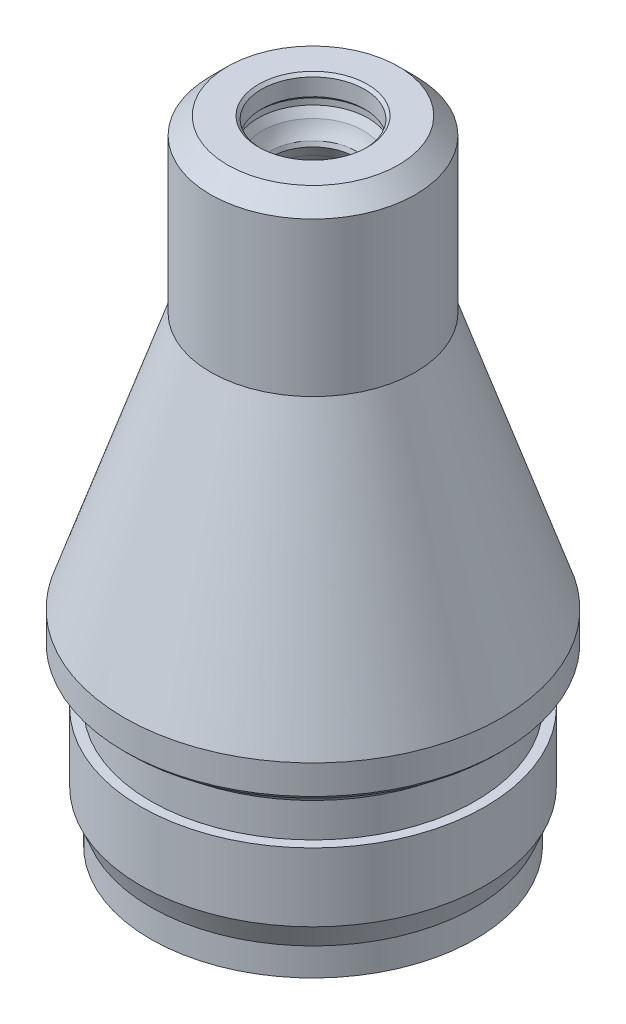
from build123d import *

# Parameters (mm, degrees)
CHAMFER_1_SIZE = 1
CHAMFER_2_SIZE = 0.1
CHAMFER_3_SIZE = 0.3


with BuildPart() as part:
    # 스케치1 → 회전1 (revolve)
    with BuildSketch(Plane(origin=(0, 0, 0), x_dir=(0, 0, -1), z_dir=(1, 0, 0))):
        with BuildLine():
            Line((4.2, 0), (4.2, 1))
            Line((4.2, 1), (4.2, 7))
            Line((4.2, 7), (4.7, 7.500000078))
            Line((4.7, 7.500000078), (4.7, 8.000000078))
            Line((4.7, 8.000000078), (4.2, 8.5))
            Line((4.2, 8.5), (4.2, 10))
            Line((4.2, 10), (4.7, 10.500000078))
            Line((4.7, 10.500000078), (4.7, 11.000000078))
            Line((4.7, 11.000000078), (4.2, 11.5))
            Line((4.2, 11.5), (4.2, 13))
            Line((4.2, 13), (4.7, 13.500000078))
            Line((4.7, 13.500000078), (4.7, 14.000000078))
            Line((4.7, 14.000000078), (4.2, 14.5))
            Line((4.2, 14.5), (4.2, 28))
            Line((4.2, 28), (3.533728258, 29.430530536))
            Line((3.533728258, 29.430530536), (2.802745502, 31))
            Line((2.802745502, 31), (2.399244734, 31.778552392))
            ThreePointArc((2.399244734, 31.778552392), (2.719290067, 32.253174869), (2.946609162, 32.778552392))
            Line((2.946609162, 32.778552392), (3.229990685, 33.260397004))
            Line((3.229990685, 33.260397004), (3.229990685, 33.62037773))
            Line((3.229990685, 33.62037773), (3.02, 33.830368416))
            Line((3.02, 33.830368416), (3.02, 34.830368416))
            Line((3.02, 34.830368416), (3.189631584, 35))
            Line((3.189631584, 35), (6, 35))
            Line((6, 35), (6, 25))
            Line((6, 25), (11.05, 10))
            Line((11.05, 10), (11.05, 8))
            Line((11.05, 8), (10.05, 8))
            Line((10.05, 8), (9.5, 7))
            Line((9.5, 7), (9.5, 5))
            Line((9.5, 5), (10.075, 5))
            Line((10.075, 5), (10.075, 1))
            Line((10.075, 1), (9.5, -0.374573668))
            Line((9.5, -0.374573668), (9.5, -2))
            Line((9.5, -2), (4.2, -2))
            Line((4.2, -2), (4.2, 0))
        make_face()
    revolve(axis=Axis((0, 0, 0), (0, 1, 0)))

    # 모따기1
    chamfer_1_edges = [part.edges().sort_by_distance(p)[0] for p in [
        (0, 35, 6),
        (0, -2, 4.2),
    ]]
    chamfer(chamfer_1_edges, length=CHAMFER_1_SIZE)

    # 모따기2
    # the kernel refuses this chamfer: 0.191354542, 0.1 mm, written as the material it takes off along each edge
    with BuildSketch(Plane(origin=(0, 31.778552392, 0), x_dir=(0, 0, -1), z_dir=(1, 0, 0))) as chamfer_2_piece_1:
        with BuildLine():
            Line((2.52619809, 0.166311611), (2.399244734 + CHAMFER_2_SIZE * 0.460143640426, -CHAMFER_2_SIZE * 0.887844485355))
            Line((2.399244734 + CHAMFER_2_SIZE * 0.460143640426, -CHAMFER_2_SIZE * 0.887844485355), (2.399244734, 0))
            ThreePointArc((2.399244734, 0), (2.466310937, 0.08495162), (2.52619809, 0.166311611))
        make_face()
    revolve(axis=Axis((0, 31.778552392, 0), (0, 1, 0)), mode=Mode.SUBTRACT)

    # 모따기3
    chamfer_3_edges = [part.edges().sort_by_distance(p)[0] for p in [
        (0, 8, 11.05),
    ]]
    chamfer(chamfer_3_edges, length=CHAMFER_3_SIZE)


solid = part.part
